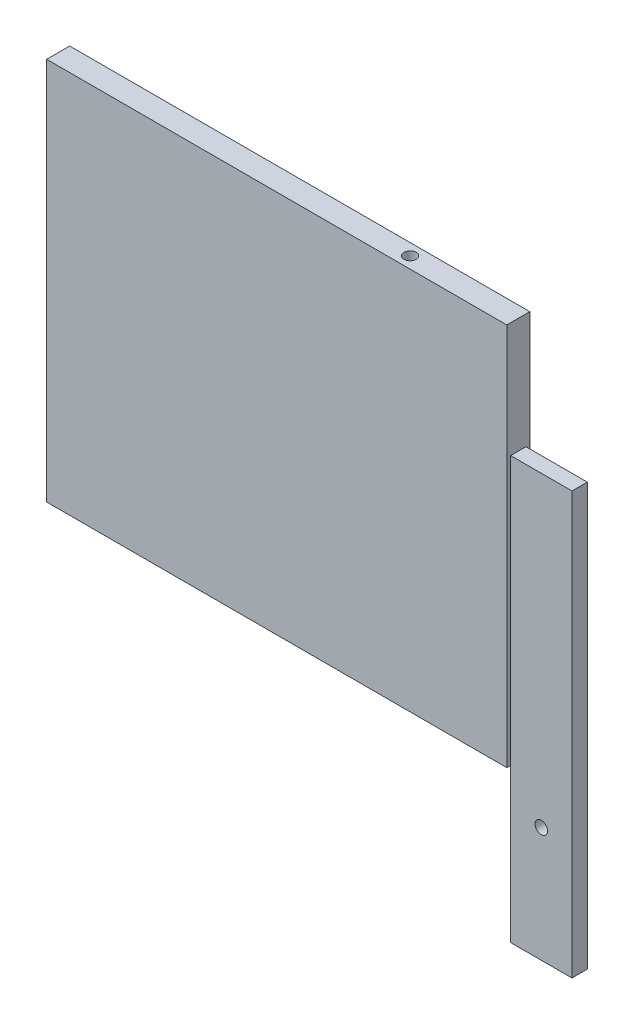
from build123d import *

# Parameters (mm, degrees)
SKETCH1_W           = 60
SKETCH1_H           = 50
BOSS_EXTRUDE1_DEPTH = 3
SKETCH6_W           = 2
SKETCH6_H           = 20
BOSS_EXTRUDE4_DEPTH = 8
CUT_EXTRUDE1_REACH  = 56.182
SKETCH7_R           = 0.794363795
SKETCH8_W           = 8
SKETCH8_H           = 2
BOSS_EXTRUDE5_DEPTH = 35
SKETCH9_R           = 0.815
CUT_EXTRUDE2_DEPTH  = 66.217863978


with BuildPart() as part:
    # Sketch1 → Boss-Extrude1 (new body)
    with BuildSketch(Plane.XY):
        with Locations((3.251028807, -5.452674897)):
            Rectangle(SKETCH1_W, SKETCH1_H)
    extrude(amount=BOSS_EXTRUDE1_DEPTH)

    # Sketch6 → Boss-Extrude4 (add)
    with BuildSketch(Plane(origin=(33.251028807, 0, 0), x_dir=(0, 0, -1), z_dir=(1, 0, 0))):
        with Locations((-1.5, -5.452674897)):
            Rectangle(SKETCH6_W, SKETCH6_H)
    extrude(amount=BOSS_EXTRUDE4_DEPTH)

    # Sketch7 → Cut-Extrude1 (cut, up to next)
    with BuildSketch(Plane.XZ.offset(15.452674897), mode=Mode.PRIVATE) as cut_extrude1_sk1:
        with Locations((19.145680917, 1.5)):
            Circle(SKETCH7_R)
    cut_extrude1_tool1 = extrude(cut_extrude1_sk1.sketch, amount=-CUT_EXTRUDE1_REACH, mode=Mode.PRIVATE) & part.part
    add(cut_extrude1_tool1.solids().sort_by_distance((19.145681, -15.452675, 1.5))[0], mode=Mode.SUBTRACT)

    # Sketch8 → Boss-Extrude5 (add)
    with BuildSketch(Plane.XZ.offset(15.452674897)):
        with Locations((37.251028807, 1.5)):
            Rectangle(SKETCH8_W, SKETCH8_H)
    extrude(amount=BOSS_EXTRUDE5_DEPTH)

    # Sketch9 → Cut-Extrude2 (cut, through all)
    with BuildSketch(Plane(origin=(0, 0, 0.5), x_dir=(-1, 0, 0), z_dir=(0, 0, -1))):
        with Locations((-37.251028807, -35.452674897)):
            Circle(SKETCH9_R)
    extrude(amount=-CUT_EXTRUDE2_DEPTH, mode=Mode.SUBTRACT)


solid = part.part
